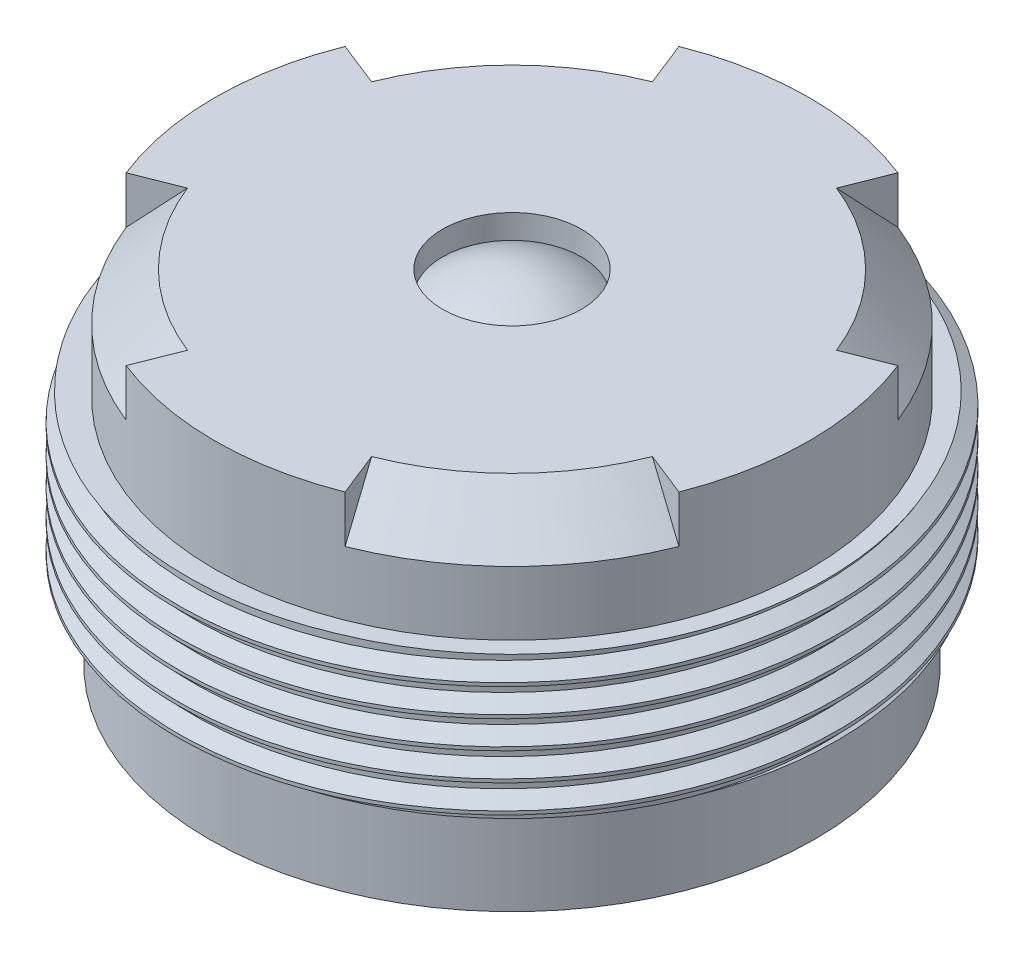
from build123d import *
from build123d.topology import SkipClean

# Parameters (mm, degrees)
SKETCH1_R                 = 2.725
BOSS_EXTRUDE1_DEPTH       = 3.08
SKETCH2_R                 = 2.11
CUT_EXTRUDE1_DEPTH        = 2.08
CUT_EXTRUDE2_REACH        = 6.933
SKETCH3_R                 = 0.625
CUT_EXTRUDE3_START        = -1
SKETCH4_R                 = 2.725
SKETCH4_R_2               = 2.675
CUT_EXTRUDE3_DEPTH        = 1
CUT_EXTRUDE4_START        = -1
CUT_EXTRUDE4_DEPTH        = 1
BOSS_EXTRUDE2_DEPTH       = 0.5
CHAMFER1_SIZE             = 0.5
BOSS_EXTRUDE3_OUTLINE_R   = 2.965
BOSS_EXTRUDE3_OUTLINE_R_2 = 2.725
BOSS_EXTRUDE3_DEPTH       = 1.28
THREAD1_PITCH             = 0.25


# Read off the part's stored shape, not the designer's step: Boss-Extrude3
with BuildPart() as part:
    # Sketch1 → Boss-Extrude1 (new body)
    with BuildSketch(Plane(origin=(0, 0, 0), x_dir=(1, 0, 0), z_dir=(0, 1, 0))):
        with Locations(Location((0, 0, 0), (0, 0, 270))):
            Circle(SKETCH1_R)
    extrude(amount=BOSS_EXTRUDE1_DEPTH)

    # Sketch2 → Cut-Extrude1 (cut)
    with BuildSketch(Plane.XZ):
        with Locations(Location((0, 0, 0), (0, 0, 270))):
            Circle(SKETCH2_R)
    extrude(amount=-CUT_EXTRUDE1_DEPTH, mode=Mode.SUBTRACT)

    # Sketch3 → Cut-Extrude2 (cut, up to next)
    with BuildSketch(Plane(origin=(0, 3.08, 0), x_dir=(1, 0, 0), z_dir=(0, 1, 0)), mode=Mode.PRIVATE) as cut_extrude2_sk1:
        with Locations(Location((0, 0, 0), (0, 0, 270))):
            Circle(SKETCH3_R)
    cut_extrude2_tool1 = extrude(cut_extrude2_sk1.sketch, amount=-CUT_EXTRUDE2_REACH, mode=Mode.PRIVATE) & part.part
    add(cut_extrude2_tool1.solids().sort_by_distance((0, 3.08, 0))[0], mode=Mode.SUBTRACT)

    # Sketch4 → Cut-Extrude3 (cut)
    with BuildSketch(Plane(origin=(0, 3.08, 0), x_dir=(1, 0, 0), z_dir=(0, 1, 0)).offset(CUT_EXTRUDE3_START)):
        with Locations(Location((0, 0, 0), (0, 0, 270))):
            Circle(SKETCH4_R)
        with Locations(Location((0, 0, 0), (0, 0, 270))):
            Circle(SKETCH4_R_2, mode=Mode.SUBTRACT)
    extrude(amount=CUT_EXTRUDE3_DEPTH, mode=Mode.SUBTRACT)

    # Sketch6 → Cut-Extrude4 (cut)
    with BuildSketch(Plane(origin=(0, 3.08, 0), x_dir=(1, 0, 0), z_dir=(0, 1, 0)).offset(CUT_EXTRUDE4_START)):
        with BuildLine():
            Line((2.0919082214541636, 0.8285046728971889), (2.487046441062172, 0.9849999999999913))
            ThreePointArc((2.487046441062172, 0.9849999999999913), (1.891510639674018, 1.8915106396740111), (0.985, 2.487046441062169))
            Line((0.985, 2.487046441062169), (0.8285046728971963, 2.0919082214541604))
            ThreePointArc((0.8285046728971963, 2.0919082214541604), (1.5909902576697348, 1.590990257669729), (2.0919082214541636, 0.8285046728971889))
        make_face()
        with BuildLine():
            Line((2.091908221454158, -0.8285046728972035), (2.4870464410621653, -0.9850000000000086))
            ThreePointArc((2.4870464410621653, -0.9850000000000086), (1.891510639674005, -1.8915106396740244), (0.9849999999999827, -2.4870464410621755))
            Line((0.9849999999999827, -2.4870464410621755), (0.8285046728971817, -2.0919082214541667))
            ThreePointArc((0.8285046728971817, -2.0919082214541667), (1.590990257669724, -1.5909902576697403), (2.091908221454158, -0.8285046728972035))
        make_face()
        with BuildLine():
            Line((-0.828504672897211, -2.0919082214541547), (-0.9850000000000173, -2.4870464410621618))
            ThreePointArc((-0.9850000000000173, -2.4870464410621618), (-1.8915106396740313, -1.891510639673998), (-2.487046441062179, -0.984999999999974))
            Line((-2.487046441062179, -0.984999999999974), (-2.0919082214541693, -0.8285046728971742))
            ThreePointArc((-2.0919082214541693, -0.8285046728971742), (-1.590990257669746, -1.5909902576697181), (-0.828504672897211, -2.0919082214541547))
        make_face()
        with BuildLine():
            Line((-2.091908221454152, 0.8285046728972181), (-2.487046441062158, 0.985000000000026))
            ThreePointArc((-2.487046441062158, 0.985000000000026), (-1.8915106396740042, 1.8915106396740247), (-0.985, 2.487046441062169))
            Line((-0.985, 2.487046441062169), (-0.8285046728971963, 2.0919082214541604))
            ThreePointArc((-0.8285046728971963, 2.0919082214541604), (-1.5909902576697232, 1.5909902576697406), (-2.091908221454152, 0.8285046728972181))
        make_face()
    extrude(amount=CUT_EXTRUDE4_DEPTH, mode=Mode.SUBTRACT)

    # Sketch7 → Boss-Extrude2 (add)
    with BuildSketch(Plane(origin=(0, 2.08, 0), x_dir=(1, 0, 0), z_dir=(0, 1, 0))):
        with BuildLine():
            Line((2.4870464410621653, -0.9850000000000086), (2.091908221454158, -0.8285046728972035))
            ThreePointArc((2.091908221454158, -0.8285046728972035), (1.590990257669724, -1.5909902576697403), (0.8285046728971817, -2.0919082214541667))
            Line((0.8285046728971817, -2.0919082214541667), (0.9849999999999827, -2.4870464410621755))
            ThreePointArc((0.9849999999999827, -2.4870464410621755), (1.891510639674005, -1.8915106396740244), (2.4870464410621653, -0.9850000000000086))
        make_face()
        with BuildLine():
            Line((2.0919082214541636, 0.8285046728971889), (2.487046441062172, 0.9849999999999913))
            ThreePointArc((2.487046441062172, 0.9849999999999913), (1.891510639674018, 1.8915106396740111), (0.985, 2.487046441062169))
            Line((0.985, 2.487046441062169), (0.8285046728971958, 2.0919082214541604))
            ThreePointArc((0.8285046728971958, 2.0919082214541604), (1.5909902576697346, 1.5909902576697292), (2.0919082214541636, 0.8285046728971889))
        make_face()
        with BuildLine():
            Line((-0.8285046728971953, 2.091908221454161), (-0.985, 2.487046441062169))
            ThreePointArc((-0.985, 2.487046441062169), (-1.8915106396740042, 1.8915106396740247), (-2.487046441062158, 0.985000000000026))
            Line((-2.487046441062158, 0.985000000000026), (-2.091908221454152, 0.8285046728972181))
            ThreePointArc((-2.091908221454152, 0.8285046728972181), (-1.5909902576697232, 1.5909902576697406), (-0.8285046728971953, 2.091908221454161))
        make_face()
        with BuildLine():
            Line((-2.09190822145417, -0.8285046728971739), (-2.487046441062179, -0.984999999999974))
            ThreePointArc((-2.487046441062179, -0.984999999999974), (-1.8915106396740313, -1.891510639673998), (-0.9850000000000173, -2.4870464410621618))
            Line((-0.9850000000000173, -2.4870464410621618), (-0.828504672897211, -2.0919082214541547))
            ThreePointArc((-0.828504672897211, -2.0919082214541547), (-1.5909902576697463, -1.5909902576697184), (-2.09190822145417, -0.8285046728971739))
        make_face()
    extrude(amount=BOSS_EXTRUDE2_DEPTH)

    # Chamfer1
    # the kernel refuses this chamfer: 0.5 mm, written as the material it adds along each edge
    with BuildSketch(Plane(origin=(-2.66e-15, 2.58, 1.33e-15), x_dir=(0.1932256914676264, 0, 0.9811543365632431), z_dir=(0.9811543365632431, 0, -0.1932256914676264))) as chamfer1_piece_1_section:
        Polygon((2.249999999999997, -CHAMFER1_SIZE), (2.249999999999997 + CHAMFER1_SIZE, 0), (2.249999999999997, 0), align=None)
    chamfer1_piece_1 = revolve(axis=Axis((-2.66e-15, 2.58, 1.33e-15), (0, -1, 0)), revolution_arc=112.28218406379256, mode=Mode.PRIVATE)
    chamfer1_piece_1 = split(chamfer1_piece_1, bisect_by=Plane(origin=(-0.21687074038711734, 3.08, 2.368112654671999), z_dir=(0, -1, 0)), keep=Keep.TOP, mode=Mode.PRIVATE)
    chamfer1_piece_1 = chamfer1_piece_1 & Plane(origin=(-2.11e-15, 2.7466294478270488, -2.55e-15), x_dir=(0.3682242990654145, 0, 0.9297369873129628), z_dir=(0, -1, 0)) * Cylinder(2.675000000000003, 11, mode=Mode.PRIVATE)
    add(chamfer1_piece_1)
    with BuildSketch(Plane(origin=(3.3e-16, 2.58, 4.4e-16), x_dir=(-0.9811543365632441, 0, 0.19322569146762147), z_dir=(0.19322569146762147, 0, 0.9811543365632441))) as chamfer1_piece_2_section:
        Polygon((2.2500000000000995 + CHAMFER1_SIZE, 0), (2.2500000000000004, -CHAMFER1_SIZE), (2.2500000000000995, 0), align=None)
    chamfer1_piece_2 = revolve(axis=Axis((3.3e-16, 2.58, 4.4e-16), (0, -1, 0)), revolution_arc=112.2821840637916, mode=Mode.PRIVATE)
    chamfer1_piece_2 = chamfer1_piece_2 & Plane(origin=(-2.11e-15, 2.7466294478339512, -2.55e-15), x_dir=(0.3682242990654145, 0, 0.9297369873129628), z_dir=(0, -1, 0)) * Cylinder(2.675000000000003, 12, mode=Mode.PRIVATE)
    chamfer1_piece_2 = split(chamfer1_piece_2, bisect_by=Plane(origin=(-2.368112654649371, 3.08, -0.21687074030521294), z_dir=(0, -1, 0)), keep=Keep.TOP, mode=Mode.PRIVATE)
    add(chamfer1_piece_2)
    with BuildSketch(Plane(origin=(2.22e-15, 2.58, -1.33e-15), x_dir=(-0.19322569146763333, 0, -0.9811543365632417), z_dir=(-0.9811543365632417, 0, 0.19322569146763333))) as chamfer1_piece_3_section:
        Polygon((2.249999999999997 + CHAMFER1_SIZE, 0), (2.25, -CHAMFER1_SIZE), (2.249999999999997, 0), align=None)
    chamfer1_piece_3 = revolve(axis=Axis((2.22e-15, 2.58, -1.33e-15), (0, -1, 0)), revolution_arc=112.28218406379254, mode=Mode.PRIVATE)
    chamfer1_piece_3 = split(chamfer1_piece_3, bisect_by=Plane(origin=(0.21687074046616822, 3.08, -2.368112654868624), z_dir=(0, -1, 0)), keep=Keep.TOP, mode=Mode.PRIVATE)
    chamfer1_piece_3 = chamfer1_piece_3 & Plane(origin=(-2.11e-15, 2.7466294475862494, -2.55e-15), x_dir=(0.3682242990654145, 0, 0.9297369873129628), z_dir=(0, -1, 0)) * Cylinder(2.675000000000003, 11, mode=Mode.PRIVATE)
    add(chamfer1_piece_3)
    with BuildSketch(Plane(origin=(2.2e-16, 2.58, 5.6e-16), x_dir=(0.9811543365632427, 0, -0.19322569146762872), z_dir=(-0.19322569146762872, 0, -0.9811543365632427))) as chamfer1_piece_4_section:
        Polygon((2.2499999999999973 + CHAMFER1_SIZE, 0), (2.250000000000001, -CHAMFER1_SIZE), (2.2499999999999973, 0), align=None)
    chamfer1_piece_4 = revolve(axis=Axis((2.2e-16, 2.58, 5.6e-16), (0, -1, 0)), revolution_arc=112.28218406379246, mode=Mode.PRIVATE)
    chamfer1_piece_4 = split(chamfer1_piece_4, bisect_by=Plane(origin=(2.368112654481027, 3.08, 0.21687074035454326), z_dir=(0, -1, 0)), keep=Keep.TOP, mode=Mode.PRIVATE)
    chamfer1_piece_4 = chamfer1_piece_4 & Plane(origin=(-2.11e-15, 2.7466294479683553, -2.55e-15), x_dir=(0.3682242990654145, 0, 0.9297369873129628), z_dir=(0, -1, 0)) * Cylinder(2.675000000000003, 11, mode=Mode.PRIVATE)
    add(chamfer1_piece_4)

    # Boss-Extrude3 outline → Boss-Extrude3 (add)
    with SkipClean():  # the faces are left unmerged after this step: merging them gives an invalid solid
        with BuildSketch(Plane(origin=(0, 0.8, 0), x_dir=(1, 0, 0), z_dir=(0, 1, 0))):
            Circle(BOSS_EXTRUDE3_OUTLINE_R)
            Circle(BOSS_EXTRUDE3_OUTLINE_R_2, mode=Mode.SUBTRACT)
        extrude(amount=BOSS_EXTRUDE3_DEPTH)

    # Thread1: the profile of Thread Profile1 profile screwed along a right-hand helix of 8 turns, 6 arcs to a turn; built about Z, then put on its axis
    with SkipClean():  # the faces are left unmerged after this step: merging them gives an invalid solid
        thread1_z = Axis((0, 0, 0), (0, 0, 1))
        thread1_corners = [(2.9653, 0, -0.000173205), (2.9653, 0, 0.218923204), (2.829683531, 0, 0.140625), (2.829683531, 0, 0.078125)]
        with BuildLine(mode=Mode.PRIVATE) as thread1_profile:
            Line(thread1_corners[0], thread1_corners[1])
            Line(thread1_corners[1], thread1_corners[2])
            Line(thread1_corners[2], thread1_corners[3])
            Line(thread1_corners[3], thread1_corners[0])
        thread1_cap = Face(thread1_profile.wire())
        thread1_turn_angles = [0, 30, 60, 90, 120, 150, 180, 210, 240, 270, 300, 330, 360]
        thread1_turn_weights = [1, 0.8660254037844387, 1, 0.8660254037844387, 1, 0.8660254037844387, 1, 0.8660254037844387, 1, 0.8660254037844387, 1, 0.8660254037844387, 1]
        thread1_turn_rails = [Edge.make_bspline([Vector(p[0], p[1], 0).rotate(thread1_z, thread1_turn_angles[k]) / thread1_turn_weights[k] + Vector(0, 0, p[2] + THREAD1_PITCH * thread1_turn_angles[k] / 360) for k in range(13)], [0, 0, 0, 1, 1, 2, 2, 3, 3, 4, 4, 5, 5, 6, 6, 6], 2, thread1_turn_weights) for p in thread1_corners]
        thread1_turn_sides = [Face.make_surface_from_curves(thread1_turn_rails[p[0]], thread1_turn_rails[p[1]]) for p in [(0, 1), (1, 2), (2, 3), (3, 0)]]
        thread1 = Plane(origin=(0, 2.58, 0), x_dir=(-1, 0, 0), z_dir=(0, -1, 0)) * Solid(Shell([*[p.moved(Location((0, 0, THREAD1_PITCH * i))) for i in range(8) for p in thread1_turn_sides], thread1_cap, thread1_cap.rotate(thread1_z, 2880).moved(Location((0, 0, THREAD1_PITCH * 2880 / 360)))]))
        add(thread1, mode=Mode.SUBTRACT)

    # Sketch12 → Revolve4 (revolve)
    with SkipClean():  # the faces are left unmerged after this step: merging them gives an invalid solid
        with BuildSketch(Plane(origin=(0, 0, 0), x_dir=(0, 0, -1), z_dir=(1, 0, 0)), mode=Mode.PRIVATE) as revolve4_sk:
            with BuildLine():
                Line((0.625, 2.8634571152629507), (0.625, 2.6509841317894454))
                add(Edge.make_bspline(
                    [(0, 2.434441247052396), (0.31250000000003764, 2.4344412470523693), (0.625, 2.6509841317894454)],
                    knots=[0.49999999999993977, 0.49999999999993977, 0.49999999999993977, 1, 1, 1], degree=2))
                Line((0, 2.434441247052396), (0, 3.08))
                add(Edge.make_bspline(
                    [(0.625, 2.8634571152629507), (0.31250000000007083, 3.0800000000000494), (0, 3.08)],
                    knots=[0, 0, 0, 0.5000000000001134, 0.5000000000001134, 0.5000000000001134], degree=2))
            make_face()
        revolve(revolve4_sk.sketch.rotate(Axis((0, 0, 0), (0, 1, 0)), 180), axis=Axis((0, 0, 0), (0, 1, 0)))


solid = part.part
